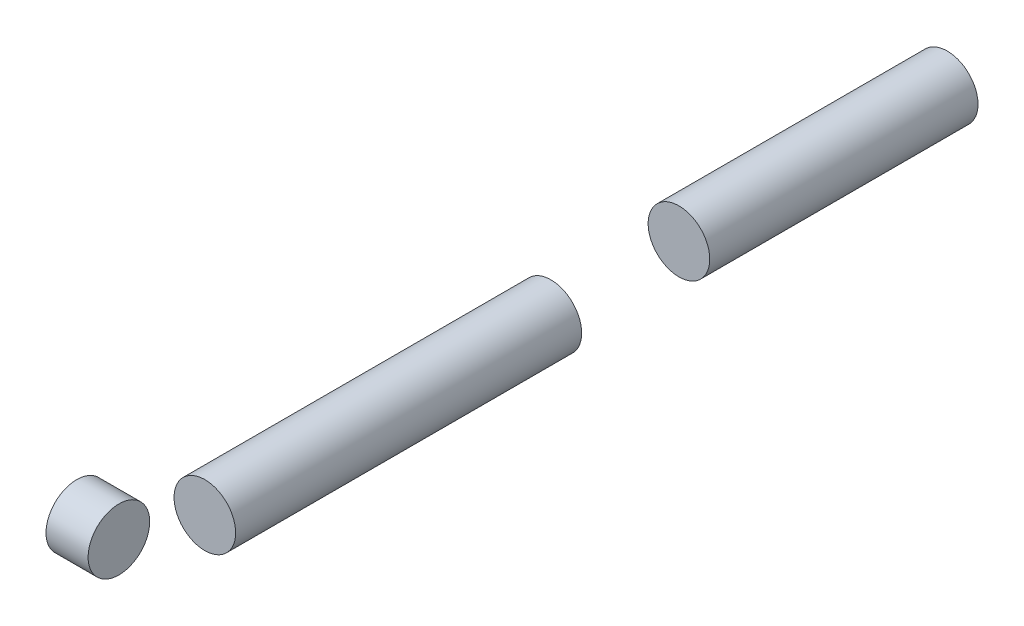
from build123d import *

# Parameters (mm, degrees)
BOSS_EXTRUDE1_OUTLINE_R = 6.35
BOSS_EXTRUDE1_DEPTH     = 55.334112963
SKETCH3_R               = 6.35
BOSS_EXTRUDE2_DEPTH     = 71.374
SKETCH4_R               = 6.350000006
BOSS_EXTRUDE3_DEPTH     = 8.687669


# Read off the part's stored shape, not the designer's step: Boss-Extrude1
with BuildPart() as part:
    # Boss-Extrude1 outline → Boss-Extrude1 (new body)
    with BuildSketch(Plane.XY.offset(-22.86)):
        Circle(BOSS_EXTRUDE1_OUTLINE_R)
    extrude(amount=BOSS_EXTRUDE1_DEPTH)


with BuildPart() as body_2:
    # Sketch3 → Boss-Extrude2 (new body)
    with BuildSketch(Plane.XY.offset(58.890112963)):
        Circle(SKETCH3_R)
    extrude(amount=BOSS_EXTRUDE2_DEPTH)


with BuildPart() as body_3:
    # Sketch4 → Boss-Extrude3 (new body)
    with BuildSketch(Plane(origin=(-13.208, 0, 0), x_dir=(0, 0, -1), z_dir=(1, 0, 0))):
        with Locations(Location((-143.472112963, 0, 0), (0, 0, 270))):
            Circle(SKETCH4_R)
    extrude(amount=BOSS_EXTRUDE3_DEPTH)


solid = Compound([part.part, body_2.part, body_3.part])
